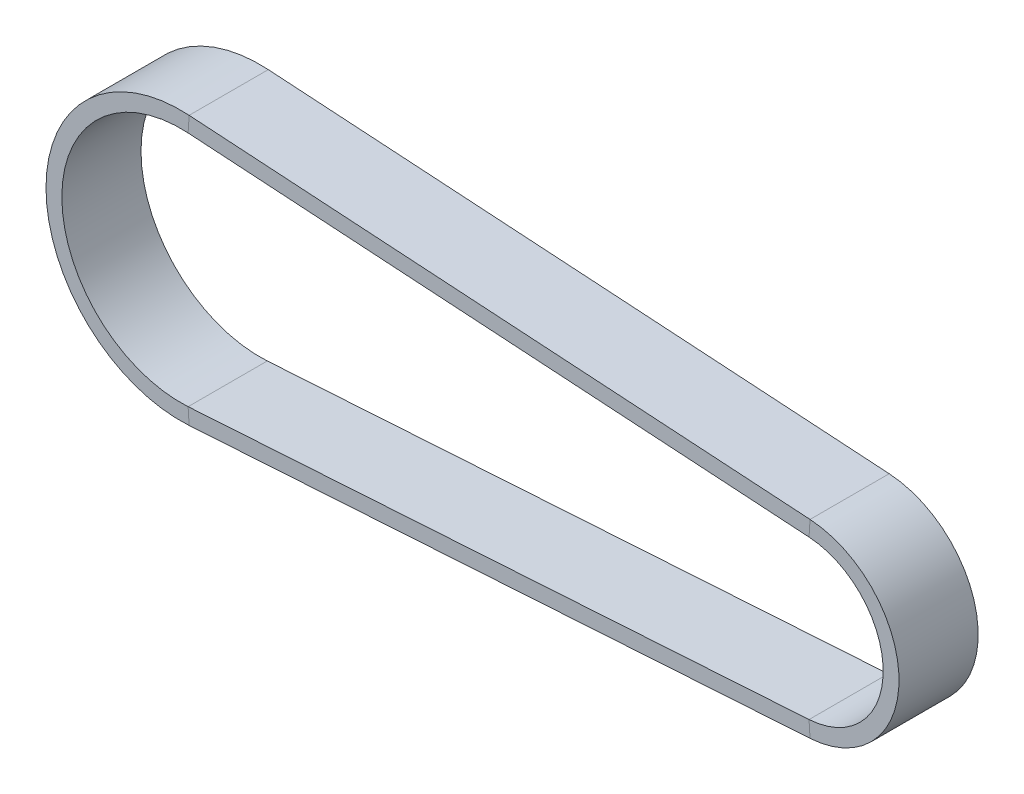
from build123d import *

# Parameters (mm, degrees)
SKIZZE2_W = 2
SKIZZE2_H = 10


with BuildPart() as part:
    # Austragung1: sweep along a path in Skizze3
    with BuildLine(Plane.XY.offset(15.5)) as austragung1_path:
        ThreePointArc((-15, 0), (-10.264362759, 10.938137737), (0.952380952, 14.969735152))
        Line((0.952380952, 14.969735152), (79.384920635, 9.979823435))
        ThreePointArc((79.384920635, 9.979823435), (86.042091824, 6.842908506), (88.75, 0))
    # Skizze2 → Austragung1 (sweep)
    with BuildSketch(Plane(origin=(0, 0, 0), x_dir=(1, 0, 0), z_dir=(0, 1, 0))):
        with Locations((-16, -15.5)):
            Rectangle(SKIZZE2_W, SKIZZE2_H)
    sweep(path=austragung1_path.line)

    # Spiegeln1: part across plane


with BuildPart() as part_1:
    add(part.part)
    add(part.part.mirror(Plane(origin=(0, 0, 0), x_dir=(0, 0, 1), z_dir=(0, -1, 0))))


solid = part_1.part
